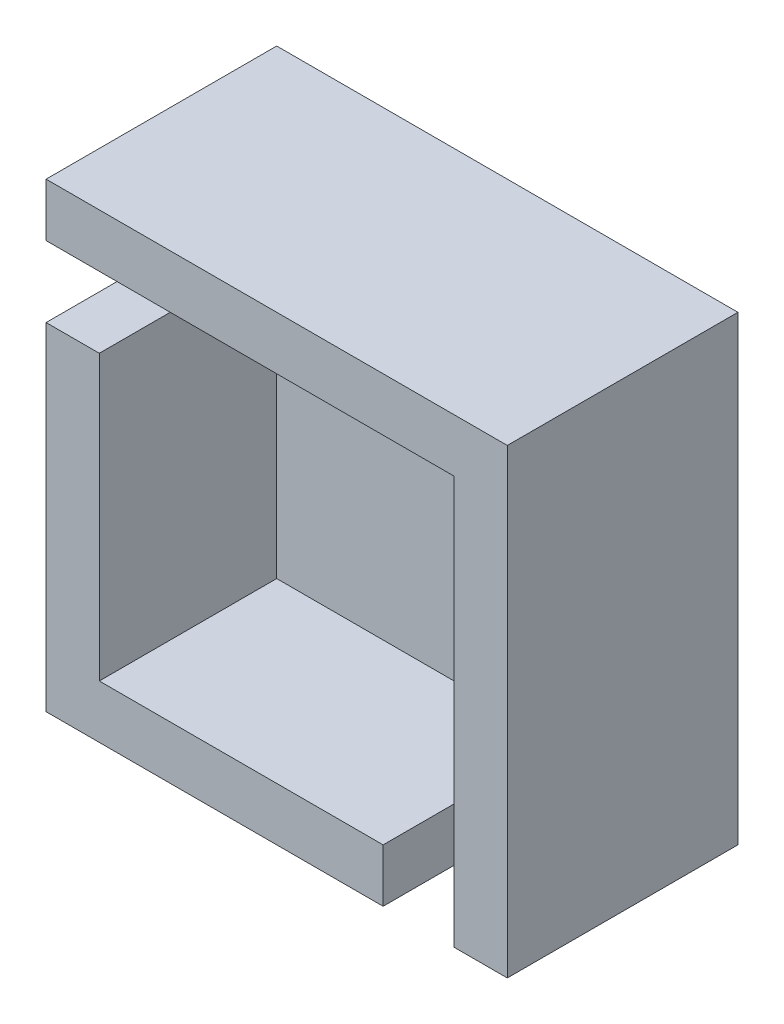
from build123d import *

# Parameters (mm, degrees)
SKETCH1_W           = 26
SKETCH1_H           = 26
BOSS_EXTRUDE5_DEPTH = 3
BOSS_EXTRUDE6_DEPTH = 10


with BuildPart() as part:
    # Sketch1 → Boss-Extrude5 (new body)
    with BuildSketch(Plane.XY):
        with Locations((-18.740064731, -2.74830583)):
            Rectangle(SKETCH1_W, SKETCH1_H)
    extrude(amount=BOSS_EXTRUDE5_DEPTH)

    # Sketch2 → Boss-Extrude6 (add)
    with BuildSketch(Plane.XY.offset(3)):
        Polygon((-31.740064731, 10.25169417), (-5.740064731, 10.25169417), (-5.740064731, -15.74830583), (-8.740064731, -15.74830583), (-8.740064731, 7.25169417), (-31.740064731, 7.25169417), align=None)
        Polygon((-31.740064731, 3.25169417), (-28.740064731, 3.25169417), (-28.740064731, -12.74830583), (-12.740064731, -12.74830583), (-12.740064731, -15.74830583), (-31.740064731, -15.74830583), align=None)
    extrude(amount=BOSS_EXTRUDE6_DEPTH)


solid = part.part
